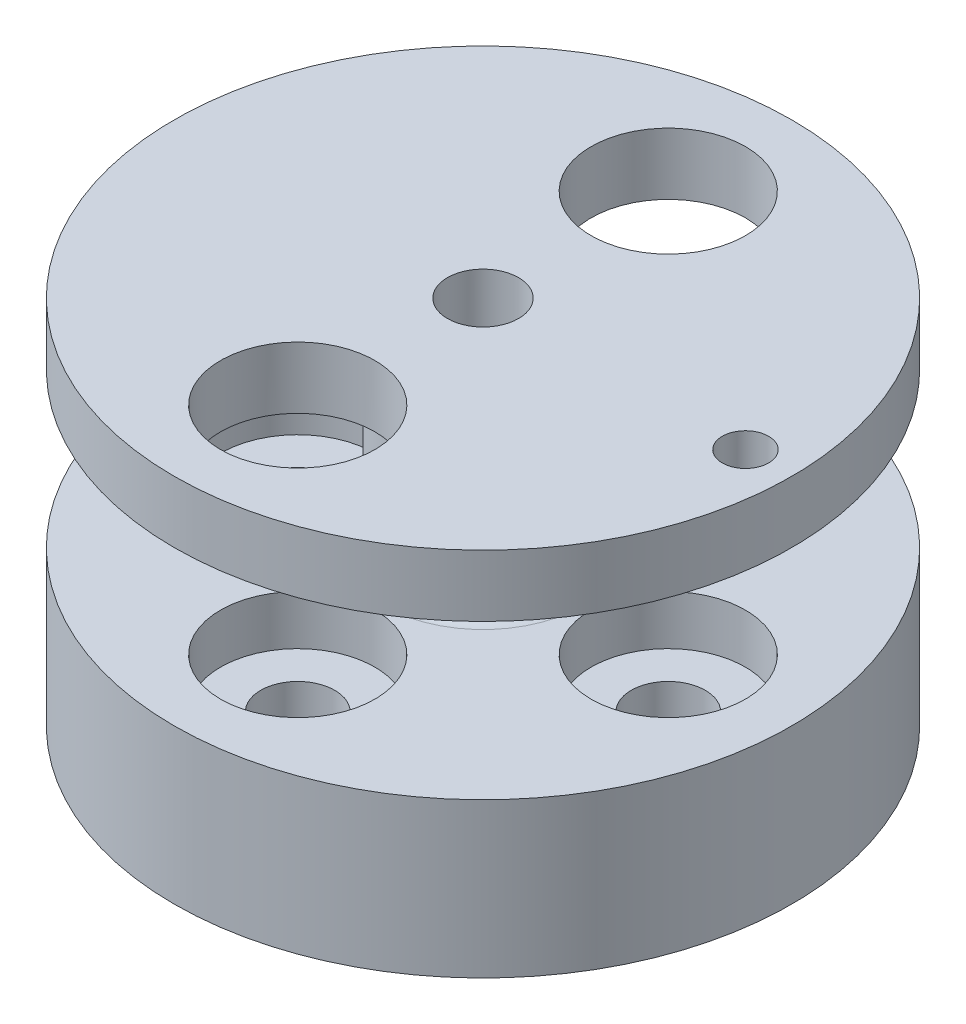
from build123d import *

# Parameters (mm, degrees)
SKETCH1_R                                = 10
BOTTOM_DEPTH                             = 5
CBORE_FOR_M2_PAN_HEAD_SCREW1_D           = 2.4
CBORE_FOR_M2_PAN_HEAD_SCREW1_CBORE_D     = 5
CBORE_FOR_M2_PAN_HEAD_SCREW1_CBORE_DEPTH = 1.6
SKETCH4_R                                = 2.75
GROOVE_DEPTH                             = 5
CIRPATTERN1_COUNT                        = 4
SKETCH7_R                                = 10
TOP_DEPTH                                = 2
SKETCH8_R                                = 0.75
THREAD_TERMINAL_DEPTH                    = 2
SKETCH9_R                                = 1.15
M2_PIN_INSERT_DEPTH                      = 7
FILLET1_R                                = 0.5
SPLIT1_START                             = 10
SPLIT1_OUTLINE_R                         = 10
SPLIT1_OUTLINE_R_2                       = 1.15
SPLIT1_OUTLINE_R_3                       = 0.75
SPLIT1_DEPTH                             = 2
SPLIT1_2_OUTLINE_R                       = 10
SPLIT1_2_OUTLINE_R_2                     = 1.15
SPLIT1_2_OUTLINE_R_3                     = 0.75
SPLIT1_2_DEPTH                           = 2
SKETCH10_R                               = 2.5
CUT_EXTRUDE1_DEPTH                       = 2
HOLES_FOR_SCREWDRIVERS_COUNT             = 2


# Read off the part's stored shape, not the designer's step: Split1
with BuildPart() as part:
    # Sketch1 → bottom (new body)
    with BuildSketch(Plane(origin=(0, 0, 0), x_dir=(1, 0, 0), z_dir=(0, 1, 0))):
        with Locations(Location((0, 0, 0), (0, 0, 270))):
            Circle(SKETCH1_R)
    extrude(amount=BOTTOM_DEPTH)

    # CBORE for M2 Pan Head Screw1 (through all)
    with Locations(Plane(origin=(0, 5, 0), x_dir=(1, 0, 0), z_dir=(0, 1, 0))):
        with Locations((6, 0)):
            cbore_for_m2_pan_head_screw1 = CounterBoreHole(CBORE_FOR_M2_PAN_HEAD_SCREW1_D / 2, CBORE_FOR_M2_PAN_HEAD_SCREW1_CBORE_D / 2, CBORE_FOR_M2_PAN_HEAD_SCREW1_CBORE_DEPTH)

    # Sketch4 → groove (add)
    with BuildSketch(Plane(origin=(0, 5, 0), x_dir=(1, 0, 0), z_dir=(0, 1, 0))):
        with Locations(Location((0, 0, 0), (0, 0, 270))):
            Circle(SKETCH4_R)
    extrude(amount=GROOVE_DEPTH)

    # CirPattern1: CBORE for M2 Pan Head Screw1 ×4 about axis
    cirpattern1_axis = Axis((0, 0, 0), (0, 1, 0))
    for i in range(1, CIRPATTERN1_COUNT):
        add(cbore_for_m2_pan_head_screw1.rotate(cirpattern1_axis, i * 360 / CIRPATTERN1_COUNT), mode=Mode.SUBTRACT)

    # Sketch7 → top (add)
    with BuildSketch(Plane(origin=(0, 10, 0), x_dir=(1, 0, 0), z_dir=(0, 1, 0))):
        with Locations(Location((0, 0, 0), (0, 0, 270))):
            Circle(SKETCH7_R)
    extrude(amount=TOP_DEPTH)

    # Sketch8 → thread_terminal (cut)
    with BuildSketch(Plane(origin=(0, 12, 0), x_dir=(1, 0, 0), z_dir=(0, 1, 0))):
        with Locations(Location((8.5, 0, 0), (0, 0, 270))):
            Circle(SKETCH8_R)
    extrude(amount=-THREAD_TERMINAL_DEPTH, mode=Mode.SUBTRACT)

    # Sketch9 → M2 pin_insert (cut)
    with BuildSketch(Plane(origin=(0, 5, 0), x_dir=(1, 0, 0), z_dir=(0, 1, 0))):
        with Locations(Location((0, 0, 0), (0, 0, 270))):
            Circle(SKETCH9_R)
    extrude(amount=M2_PIN_INSERT_DEPTH, mode=Mode.SUBTRACT)

    # Fillet1
    fillet1_edges = [part.edges().sort_by_distance(p)[0] for p in [
        (0, 5, -2.75),
    ]]
    fillet(fillet1_edges, radius=FILLET1_R)

    # Split1 2 outline → Split1 2 (cut)
    with BuildSketch(Plane(origin=(0, 0, 0), x_dir=(1, 0, 0), z_dir=(0, 1, 0)).offset(SPLIT1_START)):
        Circle(SPLIT1_2_OUTLINE_R)
        Circle(SPLIT1_2_OUTLINE_R_2, mode=Mode.SUBTRACT)
        with Locations((8.5, 0)):
            Circle(SPLIT1_2_OUTLINE_R_3, mode=Mode.SUBTRACT)
    extrude(amount=SPLIT1_2_DEPTH, mode=Mode.SUBTRACT)


with BuildPart() as body_2:
    # Split1 outline → Split1 (new body)
    with BuildSketch(Plane(origin=(0, 0, 0), x_dir=(1, 0, 0), z_dir=(0, 1, 0)).offset(SPLIT1_START)):
        Circle(SPLIT1_OUTLINE_R)
        Circle(SPLIT1_OUTLINE_R_2, mode=Mode.SUBTRACT)
        with Locations((8.5, 0)):
            Circle(SPLIT1_OUTLINE_R_3, mode=Mode.SUBTRACT)
    extrude(amount=SPLIT1_DEPTH)

    # Sketch10 → Cut-Extrude1 (cut)
    with BuildSketch(Plane(origin=(0, 12, 0), x_dir=(1, 0, 0), z_dir=(0, 1, 0))):
        with Locations(Location((0, -6, 0), (0, 0, 270))):
            Circle(SKETCH10_R)
    cut_extrude1 = extrude(amount=-CUT_EXTRUDE1_DEPTH, mode=Mode.SUBTRACT)

    # holes_for_screwdrivers: Cut-Extrude1 ×2 about axis
    holes_for_screwdrivers_axis = Axis((0, 0, 0), (0, 1, 0))
    for i in range(1, HOLES_FOR_SCREWDRIVERS_COUNT):
        add(cut_extrude1.rotate(holes_for_screwdrivers_axis, i * 360 / HOLES_FOR_SCREWDRIVERS_COUNT), mode=Mode.SUBTRACT)


solid = Compound([part.part, body_2.part])
